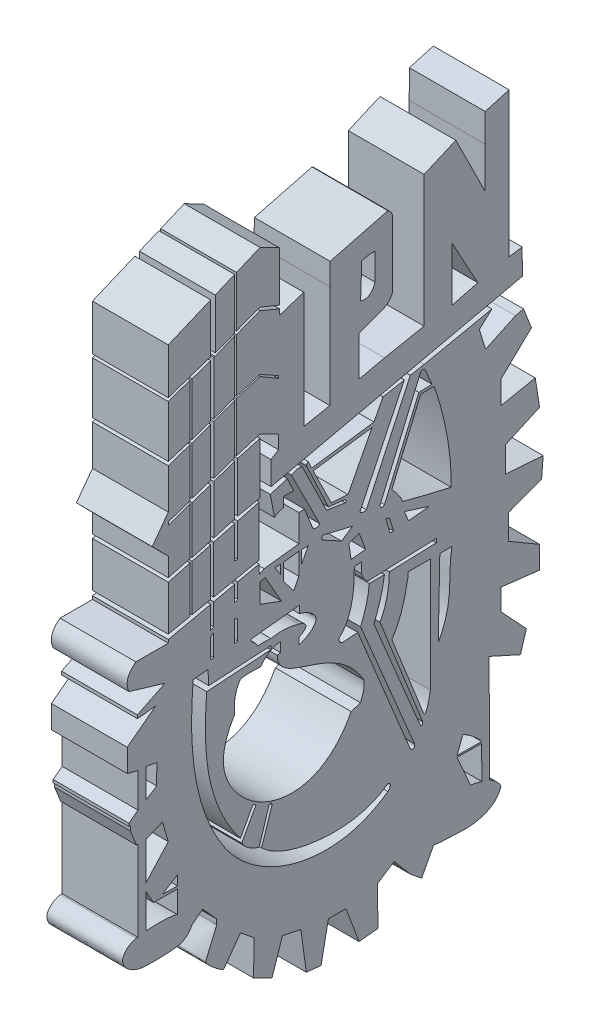
from build123d import *

# Parameters (mm, degrees)
SALIENTE_EXTRUIR1_DEPTH = 50


with BuildPart() as part:
    # Croquis1 → Saliente-Extruir1 (new body)
    # profile 1 of 43: a face of its own
    with BuildSketch(Plane(origin=(0, 0, 0), x_dir=(0, 0, -1), z_dir=(1, 0, 0))):
        Polygon((71.898749222, 423.986579651), (43.936341055, 412.250038645), (43.936341055, 382.06038761), (71.898749222, 391.521415956), align=None)
    # profile 2 of 43: a face of its own
    with BuildSketch(Plane(origin=(0, 0, 0), x_dir=(0, 0, -1), z_dir=(1, 0, 0))):
        Polygon((73.916073118, 253.199431665), (103.895805181, 259.388700441), (103.895805181, 292.514218648), (89.728183203, 288.780712422), (89.728183203, 266.926781339), (87.726805745, 266.926781339), (87.726805745, 288.253301738), (73.916073118, 284.613844367), align=None)
    # profile 3 of 43: a face of its own
    with BuildSketch(Plane(origin=(0, 0, 0), x_dir=(0, 0, -1), z_dir=(1, 0, 0))):
        Polygon((58.368181801, 385.033227833), (43.936341055, 379.908767048), (43.936341055, 345.68604184), (58.368181801, 350.141365421), align=None)
    # profile 4 of 43: a face of its own
    with BuildSketch(Plane(origin=(0, 0, 0), x_dir=(0, 0, -1), z_dir=(1, 0, 0))):
        Polygon((87.705715237, 430.621169338), (74.9479452, 425.266405531), (74.9479452, 392.199758009), (87.705715237, 396.988833984), align=None)
    # profile 5 of 43: a face of its own
    with BuildSketch(Plane(origin=(0, 0, 0), x_dir=(0, 0, -1), z_dir=(1, 0, 0))):
        Polygon((58.368181801, 348.138972285), (43.936341055, 343.228373382), (43.936341055, 316.742844044), (43.936341055, 311.080163837), (58.368181801, 315.99076274), align=None)
    # profile 6 of 43: a face of its own
    with BuildSketch(Plane(origin=(0, 0, 0), x_dir=(0, 0, -1), z_dir=(1, 0, 0))):
        Polygon((104.466666859, 437.65617129), (88.937059505, 431.137996158), (88.937059505, 397.685067551), (104.466666859, 403.514649779), align=None)
    # profile 7 of 43: a face of its own
    with BuildSketch(Plane(origin=(0, 0, 0), x_dir=(0, 0, -1), z_dir=(1, 0, 0))):
        Polygon((43.936341055, 311.080163837), (43.936341055, 316.742844044), (33.362046698, 302.30203035), (43.936341055, 291.60463238), (43.936341055, 309.262121132), align=None)
    # profile 8 of 43: a face of its own
    with BuildSketch(Plane(origin=(0, 0, 0), x_dir=(0, 0, -1), z_dir=(1, 0, 0))):
        Polygon((117.145314556, 431.137996158), (104.466666859, 437.65617129), (104.466666859, 403.514649779), (117.271614369, 398.307309176), align=None)
    # profile 9 of 43: a face of its own
    with BuildSketch(Plane(origin=(0, 0, 0), x_dir=(0, 0, -1), z_dir=(1, 0, 0))):
        Polygon((58.368181801, 314.425748049), (43.936341055, 309.262121132), (43.936341055, 291.60463238), (43.936341055, 279.260380234), (58.368181801, 283.074487302), align=None)
    # profile 10 of 43: a face of its own
    with BuildSketch(Plane(origin=(0, 0, 0), x_dir=(0, 0, -1), z_dir=(1, 0, 0))):
        with BuildLine():
            Line((127.195424074, 395.678228148), (125.612811259, 395.157013913))
            Line((125.612811259, 395.157013913), (123.325114539, 394.40358889))
            Line((123.325114539, 394.40358889), (119.278791308, 393.070981669))
            Line((119.278791308, 393.070981669), (117.195025367, 392.384718762))
            Line((117.195025367, 392.384718762), (116.633411279, 392.199758009))
            Line((116.633411279, 392.199758009), (116.633411279, 358.379950842))
            Line((116.633411279, 358.379950842), (116.633411279, 356.725577561))
            Line((116.633411279, 356.725577561), (116.633411279, 325.03830582))
            Line((116.633411279, 325.03830582), (116.633411279, 323.347956388))
            Line((116.633411279, 323.347956388), (116.633411279, 315.99076274))
            Line((116.633411279, 315.99076274), (111.720551129, 312.859427749))
            Line((111.720551129, 312.859427749), (111.720551129, 297.338928816))
            Line((111.720551129, 297.338928816), (118.018844332, 298.757778998))
            Line((118.018844332, 298.757778998), (277.47574818, 334.679488205))
            Line((277.47574818, 334.679488205), (277.333116207, 351.510061011))
            Line((277.333116207, 351.510061011), (268.715398606, 350.141365421))
            Line((268.715398606, 350.141365421), (268.715398606, 445.593998272))
            Line((268.715398606, 445.593998272), (252.965704808, 441.073429233))
            Line((252.965704808, 441.073429233), (252.825634946, 422.514172575))
            Line((252.825634946, 422.514172575), (252.825634946, 395.678228148))
            Line((252.825634946, 395.678228148), (233.601046445, 434.315058412))
            Line((233.601046445, 434.315058412), (212.688280051, 425.266405531))
            Line((212.688280051, 425.266405531), (212.654407131, 338.606665387))
            Line((212.654407131, 338.606665387), (186.53637552, 333.535575167))
            Line((186.53637552, 333.535575167), (169.745202862, 329.743408155))
            Line((169.745202862, 329.743408155), (169.745202862, 356.093117206))
            Line((169.745202862, 356.093117206), (183.700214161, 361.130563816))
            add(Edge.make_bspline(
                [(191.944134335, 368.609986726), (189.816913756, 362.970580768), (183.700214161, 361.130563816)],
                knots=[0, 0, 0, 1, 1, 1], degree=2))
            Line((191.944134335, 368.609986726), (191.944134335, 411.037188545))
            add(Edge.make_bspline(
                [(188.778092323, 416.481591911), (191.866057428, 414.547436067), (191.944134335, 411.037188545)],
                knots=[0, 0, 0, 1, 1, 1], degree=2))
            Line((188.778092323, 416.481591911), (150.689665983, 406.630514623))
            Line((150.689665983, 406.630514623), (150.532611088, 392.199758009))
            Line((150.532611088, 392.199758009), (150.532611088, 324.330689516))
            Line((150.532611088, 324.330689516), (133.2889832, 320.95991941))
            Line((133.2889832, 320.95991941), (133.2889832, 397.685067551))
            Line((133.2889832, 397.685067551), (127.195424074, 395.678228148))
        make_face()
        with BuildLine():
            Line((170.761553578, 373.778644786), (171.538337189, 396.530829336))
            add(Edge.make_bspline(
                [(171.538337189, 396.530829336), (175.222304974, 397.715856864), (180.379859683, 397.685067551)],
                knots=[0, 0, 0, 1, 1, 1], degree=2))
            Line((180.379859683, 397.685067551), (180.379859683, 379.908767048))
            add(Edge.make_bspline(
                [(170.761553578, 373.778644786), (177.432737418, 371.951536933), (180.379859683, 379.908767048)],
                knots=[0, 0, 0, 1, 1, 1], degree=2))
        make_face(mode=Mode.SUBTRACT)
        Polygon((230.978474279, 341.287804932), (230.978474279, 377.04914381), (248.107855086, 345.68604184), align=None, mode=Mode.SUBTRACT)
    # profile 11 of 43: a face of its own
    with BuildSketch(Plane(origin=(0, 0, 0), x_dir=(0, 0, -1), z_dir=(1, 0, 0))):
        Polygon((58.368181801, 280.516604257), (43.936341055, 276.713470085), (43.936341055, 252.084753531), (43.936341055, 247.010162889), (58.368181801, 249.98959383), (58.368181801, 250.770316035), align=None)
    # profile 12 of 43: a face of its own
    with BuildSketch(Plane(origin=(0, 0, 0), x_dir=(0, 0, -1), z_dir=(1, 0, 0))):
        with BuildLine():
            Line((116.633411279, 392.199758009), (117.195025367, 392.384718762))
            add(Edge.make_bspline(
                [(117.244293794, 396.194622357), (117.219659579, 394.289670459), (117.195025367, 392.384718762)],
                knots=[0.356716651, 0.356716651, 0.356716651, 1, 1, 1], degree=2))
            Line((117.244293794, 396.194622357), (104.466666859, 401.507810376))
            Line((104.466666859, 401.507810376), (104.466666859, 365.104856268))
            Line((104.466666859, 365.104856268), (116.633411279, 358.379950842))
            Line((116.633411279, 358.379950842), (116.633411279, 392.199758009))
        make_face()
    # profile 13 of 43: a face of its own
    with BuildSketch(Plane(origin=(0, 0, 0), x_dir=(0, 0, -1), z_dir=(1, 0, 0))):
        Polygon((71.898749222, 250.119644476), (43.936341055, 243.981077979), (43.936341055, 241.873751885), (43.936341055, 221.235649444), (71.898749222, 235.185414697), align=None)
    # profile 14 of 43: a face of its own
    with BuildSketch(Plane(origin=(0, 0, 0), x_dir=(0, 0, -1), z_dir=(1, 0, 0))):
        with BuildLine():
            Line((43.936341055, 221.235649444), (43.936341055, 241.873751885))
            Line((43.936341055, 241.873751885), (22.538929916, 241.873751885))
            add(Edge.make_bspline(
                [(22.538929916, 241.873751885), (14.224246836, 235.779300394), (17.997803609, 227.208813905)],
                knots=[0, 0, 0, 1, 1, 1], degree=2))
            Line((17.997803609, 227.208813905), (41.686429292, 220.111841968))
            Line((41.686429292, 220.111841968), (43.936341055, 221.235649444))
        make_face()
    # profile 15 of 43: a face of its own
    with BuildSketch(Plane(origin=(0, 0, 0), x_dir=(0, 0, -1), z_dir=(1, 0, 0))):
        Polygon((104.466666859, 365.104856268), (104.466666859, 401.507810376), (88.937059505, 395.678228148), (88.937059505, 360.388971313), align=None)
    # profile 16 of 43: a face of its own
    with BuildSketch(Plane(origin=(0, 0, 0), x_dir=(0, 0, -1), z_dir=(1, 0, 0))):
        with BuildLine():
            Line((71.898749222, 235.185414697), (43.936341055, 221.235649444))
            Line((43.936341055, 221.235649444), (41.686429292, 220.111841968))
            Line((41.686429292, 220.111841968), (23.588717704, 211.072223648))
            Line((23.588717704, 211.072223648), (23.588717704, 208.898937309))
            Line((23.588717704, 208.898937309), (35.536757225, 210.177526139))
            Line((35.536757225, 210.177526139), (42.738962819, 210.948251713))
            Line((42.738962819, 210.948251713), (60.32255463, 212.829914728))
            Line((60.32255463, 212.829914728), (70.130185405, 213.879453201))
            Line((70.130185405, 213.879453201), (98.354292369, 216.899783677))
            Line((98.354292369, 216.899783677), (111.720551129, 218.330139604))
            Line((111.720551129, 218.330139604), (118.186281565, 219.022053177))
            Line((118.186281565, 219.022053177), (130.559891325, 220.346183315))
            Line((130.559891325, 220.346183315), (166.621547717, 224.205229058))
            Line((166.621547717, 224.205229058), (171.452686877, 224.722221034))
            Line((171.452686877, 224.722221034), (239.34837422, 231.987904016))
            add(Edge.make_bspline(
                [(142.790917372, 257.143934178), (192.582301675, 246.655666331), (239.34837422, 231.987904016)],
                knots=[0, 0, 0, 1, 1, 1], degree=2))
            Line((142.790917372, 257.143934178), (130.041459975, 255.582348147))
            Line((130.041459975, 255.582348147), (117.932940925, 254.099265877))
            Line((117.932940925, 254.099265877), (107.168963064, 252.780866439))
            Line((107.168963064, 252.780866439), (103.940966718, 251.170497583))
            Line((103.940966718, 251.170497583), (89.728183203, 244.080085611))
            Line((89.728183203, 244.080085611), (87.726805745, 243.08164708))
            Line((87.726805745, 243.08164708), (73.916073118, 236.191808517))
            Line((73.916073118, 236.191808517), (71.898749222, 235.185414697))
        make_face()
        Polygon((71.898749222, 218.432718829), (40.071022525, 215.560690237), (71.898749222, 231.987904016), (73.916073118, 233.029103446), (80.350585673, 236.350142184), (87.726805745, 233.818006936), (89.728183203, 233.130966913), (119.921417504, 222.766125287), (89.728183203, 220.041587872), (87.726805745, 219.860990202), (73.916073118, 218.614755453), align=None, mode=Mode.SUBTRACT)
        Polygon((85.79239534, 238.640120878), (108.301490285, 250.770316035), (123.325114539, 225.400040329), align=None, mode=Mode.SUBTRACT)
        Polygon((111.720551129, 250.696402942), (139.464489967, 254.153673827), (126.612399461, 225.400040329), align=None, mode=Mode.SUBTRACT)
        Polygon((144.700693672, 255.068455097), (170.761553578, 247.96327152), (130.041459975, 224.806996061), align=None, mode=Mode.SUBTRACT)
        Polygon((174.619246656, 247.010162889), (226.280889498, 233.333507933), (132.356075822, 224.206910471), align=None, mode=Mode.SUBTRACT)
    # profile 17 of 43: a face of its own
    with BuildSketch(Plane(origin=(0, 0, 0), x_dir=(0, 0, -1), z_dir=(1, 0, 0))):
        Polygon((116.633411279, 325.03830582), (116.633411279, 356.725577561), (104.466666859, 363.951072191), (104.466666859, 331.130836269), align=None)
    # profile 18 of 43: a face of its own
    with BuildSketch(Plane(origin=(0, 0, 0), x_dir=(0, 0, -1), z_dir=(1, 0, 0))):
        Polygon((73.916073118, 250.562506078), (73.916073118, 236.191808517), (87.726805745, 243.08164708), (87.726805745, 253.594365856), align=None)
    # profile 19 of 43: a face of its own
    with BuildSketch(Plane(origin=(0, 0, 0), x_dir=(0, 0, -1), z_dir=(1, 0, 0))):
        Polygon((104.466666859, 331.130836269), (104.466666859, 363.951072191), (88.937059505, 359.205579357), (88.937059505, 326.385343435), align=None)
    # profile 20 of 43: a face of its own
    with BuildSketch(Plane(origin=(0, 0, 0), x_dir=(0, 0, -1), z_dir=(1, 0, 0))):
        Polygon((89.728183203, 254.033726749), (89.728183203, 244.080085611), (103.940966718, 251.170497583), (103.895805181, 257.143934178), align=None)
    # profile 21 of 43: a face of its own
    with BuildSketch(Plane(origin=(0, 0, 0), x_dir=(0, 0, -1), z_dir=(1, 0, 0))):
        Polygon((104.466666859, 294.593691959), (104.466666859, 328.617108748), (89.728183203, 324.54905227), (89.728183203, 291.611790835), align=None)
    # profile 22 of 43: a face of its own
    with BuildSketch(Plane(origin=(0, 0, 0), x_dir=(0, 0, -1), z_dir=(1, 0, 0))):
        Polygon((23.931230249, 197.716090348), (35.536757225, 210.177526139), (16.872126566, 195.968439978), (16.872126566, 180.932435704), (23.931230249, 179.134188047), align=None)
    # profile 23 of 43: a face of its own
    with BuildSketch(Plane(origin=(0, 0, 0), x_dir=(0, 0, -1), z_dir=(1, 0, 0))):
        with BuildLine():
            Line((42.738962819, 210.948251713), (35.536757225, 210.177526139))
            Line((35.536757225, 210.177526139), (23.931230249, 197.716090348))
            Line((23.931230249, 197.716090348), (23.931230249, 179.134188047))
            Line((23.931230249, 179.134188047), (23.931230249, 156.514855948))
            Line((23.931230249, 156.514855948), (23.931230249, 137.097250575))
            Line((23.931230249, 137.097250575), (23.931230249, 83.831096611))
            Line((23.931230249, 83.831096611), (22.947098005, 83.831096611))
            add(Edge.make_bspline(
                [(22.947098005, 83.831096611), (19.234712646, 83.675555653), (13.380407684, 79.049287764), (14.33984678, 69.927150792), (21.278273748, 66.068099962), (29.653879396, 64.54596886), (53.740319571, 65.052337857), (54.032212628, 67.335921664), (56.013443111, 68.342478813)],
                knots=[0, 0, 0, 0, 0.18208765, 0.22609958, 0.49674236, 0.557462277, 0.772578832, 1, 1, 1, 1], degree=3))
            add(Edge.make_bspline(
                [(56.013443111, 68.342478813), (57.951236989, 70.215335621), (59.607013616, 73.070583901)],
                knots=[0, 0, 0, 1, 1, 1], degree=2))
            add(Edge.make_bspline(
                [(54.154243966, 81.43162034), (56.045749575, 80.243554831), (59.387707173, 77.533275019), (60.142323178, 74.512585778), (59.607013616, 73.070583901)],
                knots=[0, 0, 0, 0, 0.648367557, 1, 1, 1, 1], degree=3))
            Line((54.154243966, 81.43162034), (54.154243966, 197.568555614))
            Line((54.154243966, 197.568555614), (42.738962819, 210.948251713))
        make_face()
        with BuildLine():
            Line((50.006428245, 98.480894204), (50.006428245, 83.841064303))
            add(Edge.make_bspline(
                [(50.006428245, 83.841064303), (46.163012842, 85.740114008), (31.375606902, 85.200773844), (29.085301289, 84.890033252)],
                knots=[0, 0, 0, 0, 1, 1, 1, 1], degree=3))
            Line((29.085301289, 84.890033252), (29.085301289, 107.590382288))
            Line((29.085301289, 107.590382288), (29.085301289, 112.208674811))
            Line((29.085301289, 112.208674811), (29.085301289, 137.097250575))
            Line((29.085301289, 137.097250575), (29.085301289, 159.549588882))
            Line((29.085301289, 159.549588882), (29.085301289, 178.868154715))
            Line((29.085301289, 178.868154715), (29.085301289, 199.518181191))
            Line((29.085301289, 199.518181191), (39.161497565, 209.054380311))
            Line((39.161497565, 209.054380311), (50.006428245, 197.595344196))
            Line((50.006428245, 197.595344196), (50.006428245, 106.586388182))
            Line((50.006428245, 106.586388182), (50.006428245, 100.203967153))
            Line((50.006428245, 100.203967153), (50.006428245, 98.480894204))
        make_face(mode=Mode.SUBTRACT)
    # profile 24 of 43: a face of its own
    with BuildSketch(Plane(origin=(0, 0, 0), x_dir=(0, 0, -1), z_dir=(1, 0, 0))):
        with BuildLine():
            Line((60.32255463, 212.829914728), (42.738962819, 210.948251713))
            Line((42.738962819, 210.948251713), (54.154243966, 197.568555614))
            Line((54.154243966, 197.568555614), (54.154243966, 81.43162034))
            add(Edge.make_bspline(
                [(54.154243966, 81.43162034), (56.045749575, 80.243554831), (59.387707173, 77.533275019), (60.142323178, 74.512585778), (59.607013616, 73.070583901)],
                knots=[0, 0, 0, 0, 0.648367557, 1, 1, 1, 1], degree=3))
            Line((59.607013616, 73.070583901), (66.588690944, 78.655375136))
            Line((66.588690944, 78.655375136), (75.87147495, 68.342478813))
            Line((75.87147495, 68.342478813), (75.87147495, 65.216713672))
            add(Edge.make_bspline(
                [(75.87147495, 65.216713672), (75.732447777, 63.727146112), (71.862641907, 56.118540469), (69.083086849, 49.232942015), (67.791273487, 45.736805226), (77.895172714, 38.377277636), (80.350585673, 37.175206943)],
                knots=[0, 0, 0, 0, 0.597772721, 0.693632468, 0.735053442, 1, 1, 1, 1], degree=3))
            Line((80.350585673, 37.175206943), (91.525155792, 52.577813142))
            Line((91.525155792, 52.577813142), (100.596826001, 45.365091746))
            Line((100.596826001, 45.365091746), (100.430154009, 37.169335529))
            Line((100.430154009, 37.169335529), (100.132534945, 22.534523432))
            Line((100.132534945, 22.534523432), (112.368019297, 16.557336889))
            Line((112.368019297, 16.557336889), (119.257388038, 37.169335529))
            Line((119.257388038, 37.169335529), (131.376036666, 34.652305389))
            Line((131.376036666, 34.652305389), (133.2889832, 20.577031586))
            Line((133.2889832, 20.577031586), (134.943240795, 8.405165732))
            Line((134.943240795, 8.405165732), (144.700693672, 7.36208995))
            Line((144.700693672, 7.36208995), (149.545413228, 31.640777736))
            Line((149.545413228, 31.640777736), (161.165274946, 31.596257193))
            Line((161.165274946, 31.596257193), (168.884979136, 10.833699166))
            Line((168.884979136, 10.833699166), (169.745202862, 8.520081368))
            Line((169.745202862, 8.520081368), (182.272537812, 9.802743674))
            Line((182.272537812, 9.802743674), (181.795666, 35.422285159))
            Line((181.795666, 35.422285159), (192.903280042, 42.653880918))
            Line((192.903280042, 42.653880918), (197.028784945, 37.814328324))
            Line((197.028784945, 37.814328324), (203.582254504, 30.126575832))
            Line((203.582254504, 30.126575832), (211.018693621, 24.122408133))
            Line((211.018693621, 24.122408133), (218.934140282, 39.023029963))
            add(Edge.make_bspline(
                [(218.934140282, 39.023029963), (212.733337731, 40.127804057), (206.660253852, 42.708964891), (202.041098184, 49.007813529)],
                knots=[0.724993146, 0.724993146, 0.724993146, 0.724993146, 1, 1, 1, 1], degree=3))
            add(Edge.make_bspline(
                [(202.041098184, 49.007813529), (205.210483516, 55.557876549), (211.132185441, 58.898690381), (217.917663918, 60.48292828)],
                knots=[0, 0, 0, 0, 0.448656408, 0.448656408, 0.448656408, 0.448656408], degree=3))
            Line((217.917663918, 60.48292828), (218.934140282, 128.552553502))
            Line((218.934140282, 128.552553502), (222.438605284, 136.285356324))
            Line((222.438605284, 136.285356324), (221.991157786, 61.222727363))
            add(Edge.make_bspline(
                [(221.991157786, 61.222727363), (229.27500406, 62.205794954), (237.08570771, 61.618271066), (243.341783668, 61.061243113)],
                knots=[0.53655709, 0.53655709, 0.53655709, 0.53655709, 1, 1, 1, 1], degree=3))
            Line((243.341783668, 61.061243113), (234.348305634, 81.43162034))
            Line((234.348305634, 81.43162034), (250.623186624, 81.261619494))
            Line((250.623186624, 81.261619494), (250.745345744, 59.474765525))
            Line((250.745345744, 59.474765525), (250.625856403, 45.365091746))
            Line((250.625856403, 45.365091746), (255.942429299, 48.448263))
            Line((255.942429299, 48.448263), (255.915145483, 57.796638695))
            Line((255.915145483, 57.796638695), (255.846661478, 81.261619494))
            Line((255.846661478, 81.261619494), (255.771166218, 107.128898098))
            Line((255.771166218, 107.128898098), (255.487518656, 107.590382288))
            Line((255.487518656, 107.590382288), (255.487518656, 114.852061232))
            Line((255.487518656, 114.852061232), (255.487518656, 128.552553502))
            Line((255.487518656, 128.552553502), (255.708933405, 128.452005148))
            Line((255.708933405, 128.452005148), (276.192060423, 119.150254885))
            Line((276.192060423, 119.150254885), (280.126324536, 132.099961346))
            Line((280.126324536, 132.099961346), (263.365817499, 150.073915409))
            Line((263.365817499, 150.073915409), (263.365817499, 164.154268056))
            Line((263.365817499, 164.154268056), (285.020127066, 161.611143474))
            Line((285.020127066, 161.611143474), (288.851099201, 161.161226593))
            Line((288.851099201, 161.161226593), (288.851099201, 175.896199949))
            Line((288.851099201, 175.896199949), (268.337018723, 187.83883529))
            Line((268.337018723, 187.83883529), (268.337018723, 204.316331022))
            Line((268.337018723, 204.316331022), (290.148691794, 212.472387059))
            Line((290.148691794, 212.472387059), (291.211524846, 225.400040329))
            Line((291.211524846, 225.400040329), (266.217562697, 227.208813905))
            Line((266.217562697, 227.208813905), (266.217562697, 243.981077979))
            Line((266.217562697, 243.981077979), (288.851099201, 254.153673827))
            Line((288.851099201, 254.153673827), (285.958276826, 272.396479961))
            Line((285.958276826, 272.396479961), (283.466291043, 271.893917233))
            Line((283.466291043, 271.893917233), (263.365817499, 267.840222825))
            Line((263.365817499, 267.840222825), (263.365817499, 283.074487302))
            Line((263.365817499, 283.074487302), (283.466291043, 302.30203035))
            Line((283.466291043, 302.30203035), (278.188908044, 315.709435805))
            Line((278.188908044, 315.709435805), (272.911525046, 314.425748049))
            Line((272.911525046, 314.425748049), (253.225220105, 305.154669808))
            Line((253.225220105, 305.154669808), (249.065004853, 318.42419809))
            Line((249.065004853, 318.42419809), (257.385435357, 326.051259386))
            Line((257.385435357, 326.051259386), (212.654407131, 316.742844044))
            add(Edge.make_bspline(
                [(212.654407131, 316.742844044), (208.118330991, 315.91312907), (203.582254504, 315.083414032)],
                knots=[0, 0, 0, 0.33500761, 0.33500761, 0.33500761], degree=2))
            Line((203.582254504, 315.083414032), (174.619246656, 252.780866439))
            add(Edge.make_bspline(
                [(170.297961352, 253.594365856), (171.892123894, 251.693236248), (174.619246656, 252.780866439)],
                knots=[0, 0, 0, 1, 1, 1], degree=2))
            Line((170.297961352, 253.594365856), (199.594270513, 314.353953164))
            add(Edge.make_bspline(
                [(199.594270513, 314.353953164), (192.584119751, 313.071693589), (185.573968629, 311.789433949)],
                knots=[0.48227199, 0.48227199, 0.48227199, 1, 1, 1], degree=2))
            add(Edge.make_bspline(
                [(185.573968629, 311.789433949), (182.592191263, 306.068084615), (179.610413733, 300.346734965)],
                knots=[0, 0, 0, 0.258232773, 0.258232773, 0.258232773], degree=2))
            Line((179.610413733, 300.346734965), (138.506772685, 294.593691959))
            add(Edge.make_bspline(
                [(138.506772685, 294.593691959), (137.392080356, 297.014002199), (136.277388091, 299.434312303)],
                knots=[0.300497837, 0.300497837, 0.300497837, 1, 1, 1], degree=2))
            add(Edge.make_bspline(
                [(135.266571951, 297.338928816), (134.870880609, 298.961406578), (136.277388091, 299.434312303)],
                knots=[0, 0, 0, 1, 1, 1], degree=2))
            Line((135.266571951, 297.338928816), (149.545413228, 266.926781339))
            Line((149.545413228, 266.926781339), (160.645964076, 265.664802508))
            add(Edge.make_bspline(
                [(160.645964076, 265.664802508), (161.680785322, 264.450529379), (160.645964076, 263.673357213)],
                knots=[0, 0, 0, 1, 1, 1], degree=2))
            Line((160.645964076, 263.673357213), (148.284801988, 265.664802508))
            Line((148.284801988, 265.664802508), (132.204518379, 298.589566069))
            add(Edge.make_bspline(
                [(125.128949693, 297.354915811), (128.600185523, 299.430452004), (132.204518379, 298.589566069)],
                knots=[0, 0, 0, 1, 1, 1], degree=2))
            Line((125.128949693, 297.354915811), (143.705022729, 260.325107588))
            add(Edge.make_bspline(
                [(139.464489967, 259.388700441), (142.735924023, 258.020193927), (143.705022729, 260.325107588)],
                knots=[0, 0, 0, 1, 1, 1], degree=2))
            Line((139.464489967, 259.388700441), (133.748065414, 273.569695156))
            add(Edge.make_bspline(
                [(130.041459975, 273.444690802), (131.655793121, 273.486869527), (133.085863297, 273.534299095), (133.748065414, 273.569695156)],
                knots=[0.748912607, 0.748912607, 0.748912607, 0.748912607, 1, 1, 1, 1], degree=3))
            Line((130.041459975, 273.444690802), (130.041459975, 255.582348147))
            Line((130.041459975, 255.582348147), (142.790917372, 257.143934178))
            add(Edge.make_bspline(
                [(142.790917372, 257.143934178), (192.582301675, 246.655666331), (239.34837422, 231.987904016)],
                knots=[0, 0, 0, 1, 1, 1], degree=2))
            Line((239.34837422, 231.987904016), (171.452686877, 224.722221034))
            Line((171.452686877, 224.722221034), (171.528049386, 217.613507032))
            add(Edge.make_bspline(
                [(171.528049386, 217.613507032), (172.086082654, 214.374097571), (175.462247484, 211.506692073)],
                knots=[0, 0, 0, 1, 1, 1], degree=2))
            Line((175.462247484, 211.506692073), (220.694133552, 213.35501426))
            Line((220.694133552, 213.35501426), (220.694133552, 210.798170604))
            Line((220.694133552, 210.798170604), (189.770843452, 209.747975905))
            add(Edge.make_bspline(
                [(189.770843452, 209.747975905), (189.569081448, 194.456224186), (183.523520796, 184.145461777)],
                knots=[0, 0, 0, 1, 1, 1], degree=2))
            Line((183.523520796, 184.145461777), (211.682768479, 113.279540916))
            add(Edge.make_bspline(
                [(210.351174226, 111.404848211), (212.041762212, 111.071513561), (211.682768479, 113.279540916)],
                knots=[0, 0, 0, 1, 1, 1], degree=2))
            Line((210.351174226, 111.404848211), (179.610413733, 184.83377358))
            add(Edge.make_bspline(
                [(186.53637552, 209.747975905), (185.233178505, 201.258530327), (183.47701006, 194.733846879), (179.610413733, 184.83377358)],
                knots=[0, 0, 0, 0, 1, 1, 1, 1], degree=3))
            Line((186.53637552, 209.747975905), (176.505758741, 209.747975905))
            add(Edge.make_bspline(
                [(176.505758741, 209.747975905), (175.936690638, 200.354149175), (170.761553578, 187.83883529)],
                knots=[0, 0, 0, 1, 1, 1], degree=2))
            Line((170.761553578, 187.83883529), (206.399902149, 103.130655057))
            add(Edge.make_bspline(
                [(203.582254504, 101.560985634), (206.572136399, 99.267927785), (206.399902149, 103.130655057)],
                knots=[0, 0, 0, 1, 1, 1], degree=2))
            Line((203.582254504, 101.560985634), (168.884979136, 185.611460089))
            Line((168.884979136, 185.611460089), (158.48699204, 184.83377358))
            add(Edge.make_bspline(
                [(158.48699204, 184.83377358), (155.947829411, 186.363177492), (156.492081601, 188.437840434)],
                knots=[0, 0, 0, 1, 1, 1], degree=2))
            add(Edge.make_bspline(
                [(166.621547717, 224.205229058), (167.197353641, 197.859513468), (156.492081601, 188.437840434)],
                knots=[0, 0, 0, 1, 1, 1], degree=2))
            Line((166.621547717, 224.205229058), (130.559891325, 220.346183315))
            Line((130.559891325, 220.346183315), (130.370984642, 215.560690237))
            add(Edge.make_bspline(
                [(130.183628074, 197.568555614), (136.163503899, 199.885747373), (140.76354054, 203.146835313), (141.87531259, 209.575621376), (136.902949826, 213.736985919), (130.370984642, 215.560690237)],
                knots=[0, 0, 0, 0, 0.484081153, 0.584081153, 1, 1, 1, 1], degree=3))
            Line((130.183628074, 197.568555614), (130.103190859, 202.053834688))
            add(Edge.make_bspline(
                [(130.103190859, 202.053834688), (139.298707612, 206.833206015), (130.041459975, 209.747975905)],
                knots=[0, 0, 0, 1, 1, 1], degree=2))
            add(Edge.make_bspline(
                [(130.041459975, 209.747975905), (120.710800902, 212.619082219), (111.720551129, 210.629531151)],
                knots=[0, 0, 0, 1, 1, 1], degree=2))
            add(Edge.make_bspline(
                [(111.720551129, 210.629531151), (108.903716419, 211.089180352), (105.752838828, 211.119156805), (102.652444638, 210.798170604)],
                knots=[0.467168194, 0.467168194, 0.467168194, 0.467168194, 1, 1, 1, 1], degree=3))
            add(Edge.make_bspline(
                [(102.652444638, 210.798170604), (102.482988106, 213.707594308), (98.212600522, 214.28684073), (98.354292369, 216.899783677)],
                knots=[0, 0, 0, 0, 1, 1, 1, 1], degree=3))
            Line((98.354292369, 216.899783677), (70.130185405, 213.879453201))
            Line((70.130185405, 213.879453201), (70.587879511, 204.316331022))
            Line((70.587879511, 204.316331022), (111.720551129, 206.659728751))
            Line((111.720551129, 206.659728751), (111.561856804, 204.316331022))
            Line((111.561856804, 204.316331022), (69.250473424, 201.532630536))
            add(Edge.make_bspline(
                [(69.250473424, 201.532630536), (66.677779768, 167.240465015), (68.64080152, 136.650690838), (91.525155792, 106.586388182)],
                knots=[0, 0, 0, 0, 1, 1, 1, 1], degree=3))
            Line((91.525155792, 106.586388182), (99.68211487, 121.593436697))
            add(Edge.make_bspline(
                [(99.68211487, 121.593436697), (101.515439836, 121.344877852), (101.661463473, 120.418198465)],
                knots=[0, 0, 0, 1, 1, 1], degree=2))
            Line((101.661463473, 120.418198465), (92.321412254, 103.531880697))
            add(Edge.make_bspline(
                [(92.321412254, 103.531880697), (95.793395591, 97.624042673), (103.895805181, 95.367067711)],
                knots=[0, 0, 0, 1, 1, 1], degree=2))
            Line((103.895805181, 95.367067711), (110.444822898, 116.459501259))
            add(Edge.make_bspline(
                [(110.444822898, 116.459501259), (112.247204399, 117.406238503), (112.368019297, 115.34611767)],
                knots=[0, 0, 0, 1, 1, 1], degree=2))
            Line((112.368019297, 115.34611767), (105.496451391, 94.253684122))
            add(Edge.make_bspline(
                [(105.496451391, 94.253684122), (115.175889158, 84.231563107), (153.484077112, 74.942868505), (180.54798104, 82.848811002), (188.778092323, 89.341770114)],
                knots=[0, 0, 0, 0, 0.556817536, 1, 1, 1, 1], degree=3))
            add(Edge.make_bspline(
                [(188.778092323, 89.341770114), (191.267345676, 88.437818151), (190.579842957, 86.511934448), (188.778092323, 84.731006526)],
                knots=[0, 0, 0, 0, 1, 1, 1, 1], degree=3))
            add(Edge.make_bspline(
                [(60.32255463, 212.829914728), (56.766724573, 169.883996556), (63.6965921, 133.800281889), (92.845205203, 87.421672718), (134.716578412, 65.242240696), (175.146683856, 75.061935511), (188.778092323, 84.731006526)],
                knots=[0, 0, 0, 0, 0.417407266, 0.504328644, 0.828670982, 1, 1, 1, 1], degree=3))
        make_face()
        with BuildLine():
            add(Edge.make_bspline(
                [(118.052432532, 205.849157403), (114.955767409, 205.912174292), (109.07955416, 204.031844742), (104.841704616, 197.830511785)],
                knots=[0, 0, 0, 0, 0.841601778, 0.841601778, 0.841601778, 0.841601778], degree=3))
            Line((118.052432532, 205.849157403), (117.932940925, 199.518181191))
            add(Edge.make_bspline(
                [(117.932940925, 199.518181191), (117.191732045, 199.383833298), (116.463045652, 199.23443792), (115.746746886, 199.070669276)],
                knots=[0, 0, 0, 0, 0.008373394, 0.008373394, 0.008373394, 0.008373394], degree=3))
            add(Edge.make_bspline(
                [(115.746746886, 199.070669276), (115.991346588, 189.118688024), (145.263365914, 180.698760314), (163.315297115, 172.760391822), (172.875023528, 156.514855948)],
                knots=[0, 0, 0, 0, 0.341113223, 1, 1, 1, 1], degree=3))
            add(Edge.make_bspline(
                [(172.875023528, 156.514855948), (173.932040777, 151.896426772), (171.847754815, 148.137705812), (170.761553578, 144.43871096)],
                knots=[0, 0, 0, 0, 1, 1, 1, 1], degree=3))
            Line((170.761553578, 144.43871096), (164.5465746, 142.522392357))
            add(Edge.make_bspline(
                [(87.726805744, 179.334484572), (83.831925365, 173.333906202), (80.486786651, 163.912806098), (79.681891699, 146.431150194), (89.379300678, 129.751901447), (121.330146242, 110.668846998), (150.210646335, 114.711429684), (164.5465746, 142.522392357)],
                knots=[0.16451657, 0.16451657, 0.16451657, 0.16451657, 0.272846567, 0.326121243, 0.568552309, 0.638970574, 1, 1, 1, 1], degree=3))
            add(Edge.make_bspline(
                [(87.726805744, 179.334484572), (86.428311196, 189.937575174), (91.525155792, 197.568555614)],
                knots=[0, 0, 0, 1, 1, 1], degree=2))
            add(Edge.make_bspline(
                [(91.525155792, 197.568555614), (95.777870718, 198.657452479), (104.841704616, 197.830511785)],
                knots=[0, 0, 0, 1, 1, 1], degree=2))
        make_face(mode=Mode.SUBTRACT)
        with BuildLine():
            add(Edge.make_bspline(
                [(238.299345217, 92.598936252), (245.931170943, 88.413821487), (250.623186624, 82.383280807)],
                knots=[0, 0, 0, 1, 1, 1], degree=2))
            Line((250.623186624, 82.383280807), (234.348305634, 82.513297368))
            Line((234.348305634, 82.513297368), (238.299345217, 92.598936252))
        make_face(mode=Mode.SUBTRACT)
        with BuildLine():
            add(Edge.make_bspline(
                [(216.769981435, 128.552553502), (215.039851302, 117.628995158), (212.654407131, 116.874793419)],
                knots=[0, 0, 0, 1, 1, 1], degree=2))
            Line((212.654407131, 116.874793419), (191.353422326, 170.159912237))
            add(Edge.make_bspline(
                [(191.353422326, 170.159912237), (198.4820955, 179.963723512), (202.003914728, 200.521251894)],
                knots=[0, 0, 0, 1, 1, 1], degree=2))
            Line((202.003914728, 200.521251894), (202.003914728, 203.55816209))
            Line((202.003914728, 203.55816209), (216.769981435, 203.55816209))
            Line((216.769981435, 203.55816209), (216.769981435, 200.521251894))
            Line((216.769981435, 200.521251894), (216.769981435, 128.552553502))
        make_face(mode=Mode.SUBTRACT)
        with BuildLine():
            Line((221.991157786, 152.858215069), (223.022837663, 203.55816209))
            Line((223.022837663, 203.55816209), (230.978474279, 203.55816209))
            add(Edge.make_bspline(
                [(230.978474279, 203.55816209), (227.65858888, 184.829767026), (233.164326963, 174.839855406), (221.991157786, 152.858215069)],
                knots=[0, 0, 0, 0, 1, 1, 1, 1], degree=3))
        make_face(mode=Mode.SUBTRACT)
        with BuildLine():
            Line((162.480249784, 267.477865137), (151.437102272, 268.279736081))
            Line((151.437102272, 268.279736081), (139.464489967, 292.514218648))
            Line((139.464489967, 292.514218648), (178.321784535, 297.874150028))
            add(Edge.make_bspline(
                [(178.321784535, 297.874150028), (170.401017242, 282.67600774), (162.480249784, 267.477865137)],
                knots=[0.31403276, 0.31403276, 0.31403276, 1, 1, 1], degree=2))
        make_face(mode=Mode.SUBTRACT)
        with BuildLine():
            add(Edge.make_bspline(
                [(191.353422326, 255.793666639), (196.454232281, 250.782577783), (198.528679774, 245.517932325)],
                knots=[0, 0, 0, 1, 1, 1], degree=2))
            Line((191.353422326, 255.793666639), (210.351174226, 300.731725134))
            add(Edge.make_bspline(
                [(210.351174226, 300.731725134), (214.5150485, 301.221126974), (219.350425752, 300.871581631)],
                knots=[0, 0, 0, 1, 1, 1], degree=2))
            add(Edge.make_bspline(
                [(219.350425752, 300.871581631), (230.764293995, 267.605322741), (230.536208273, 237.678754162)],
                knots=[0, 0, 0, 1, 1, 1], degree=2))
            add(Edge.make_bspline(
                [(230.536208273, 237.678754162), (214.873222137, 241.126491687), (198.528679774, 245.517932325)],
                knots=[0, 0, 0, 1, 1, 1], degree=2))
        make_face(mode=Mode.SUBTRACT)
        with BuildLine():
            add(Edge.make_bspline(
                [(183.523520796, 250.696402942), (184.328118121, 247.816928012), (186.53637552, 249.770851353)],
                knots=[0, 0, 0, 1, 1, 1], degree=2))
            Line((183.523520796, 250.696402942), (210.351174226, 313.546178381))
            add(Edge.make_bspline(
                [(210.351174226, 313.546178381), (211.978964545, 314.893756038), (213.265288671, 313.546178381)],
                knots=[0, 0, 0, 1, 1, 1], degree=2))
            Line((213.265288671, 313.546178381), (217.917663918, 302.738485235))
            Line((217.917663918, 302.738485235), (209.183776515, 302.549984068))
            Line((209.183776515, 302.549984068), (186.53637552, 249.770851353))
        make_face(mode=Mode.SUBTRACT)
    # profile 25 of 43: a face of its own
    with BuildSketch(Plane(origin=(0, 0, 0), x_dir=(0, 0, -1), z_dir=(1, 0, 0))):
        with BuildLine():
            Line((117.920320202, 295.220908523), (111.215717999, 293.226679219))
            Line((111.215717999, 293.226679219), (114.036779459, 278.60301917))
            add(Edge.make_bspline(
                [(120.049195325, 281.39567388), (117.705250786, 280.950355201), (115.172081456, 279.865550804), (114.036779459, 278.60301917)],
                knots=[0, 0, 0, 0, 1, 1, 1, 1], degree=3))
            Line((120.049195325, 281.39567388), (119.921417504, 287.724184317))
            Line((119.921417504, 287.724184317), (126.612399461, 287.601872357))
            Line((126.612399461, 287.601872357), (122.443755326, 296.566367449))
            Line((122.443755326, 296.566367449), (117.920320202, 295.220908523))
        make_face()
    # profile 26 of 43: a face of its own
    with BuildSketch(Plane(origin=(0, 0, 0), x_dir=(0, 0, -1), z_dir=(1, 0, 0))):
        Polygon((23.931230249, 137.097250575), (23.931230249, 156.514855948), (17.997803609, 151.997832713), (17.997803609, 150.073915409), (18.959762261, 150.073915409), (18.959762261, 147.146215165), (22.947098005, 137.097250575), align=None)
    # profile 27 of 43: a face of its own
    with BuildSketch(Plane(origin=(0, 0, 0), x_dir=(0, 0, -1), z_dir=(1, 0, 0))):
        Polygon((34.251364819, 98.617139135), (50.006428245, 98.480894204), (50.006428245, 100.203967153), (40.071022525, 100.391685419), (50.006428245, 106.586388182), (50.006428245, 197.595344196), (39.161497565, 209.054380311), (29.085301289, 199.518181191), (29.085301289, 178.868154715), (36.367087045, 177.444232988), (36.26962457, 164.154268056), (29.085301289, 159.549588882), (29.085301289, 137.097250575), (40.071022525, 141.70037157), (43.936341055, 128.552553502), (29.085301289, 112.208674811), (29.085301289, 107.590382288), align=None)
    # profile 28 of 43: a face of its own
    with BuildSketch(Plane(origin=(0, 0, 0), x_dir=(0, 0, -1), z_dir=(1, 0, 0))):
        with BuildLine():
            add(Edge.make_bspline(
                [(218.934140282, 39.023029963), (212.733337731, 40.127804057), (206.660253852, 42.708964891), (202.041098184, 49.007813529)],
                knots=[0.724993146, 0.724993146, 0.724993146, 0.724993146, 1, 1, 1, 1], degree=3))
            add(Edge.make_bspline(
                [(238.299345217, 37.814328324), (237.17828143, 37.86367533), (231.486619282, 38.274926366), (224.49363155, 38.032515933), (218.934140282, 39.023029963)],
                knots=[0.420476198, 0.420476198, 0.420476198, 0.420476198, 0.478428578, 0.724993146, 0.724993146, 0.724993146, 0.724993146], degree=3))
            add(Edge.make_bspline(
                [(263.365817499, 50.777203469), (261.021373959, 40.897996653), (247.446122799, 37.572716999), (239.112738277, 37.778524373), (238.299345217, 37.814328324)],
                knots=[0, 0, 0, 0, 0.378428578, 0.420476198, 0.420476198, 0.420476198, 0.420476198], degree=3))
            add(Edge.make_bspline(
                [(263.365817499, 50.777203469), (261.523283961, 53.982414835), (257.943242808, 56.503496206)],
                knots=[0, 0, 0, 0.789844939, 0.789844939, 0.789844939], degree=2))
            add(Edge.make_bspline(
                [(257.943242808, 56.503496206), (256.990696643, 57.174283576), (255.915145483, 57.796638695)],
                knots=[0.789844939, 0.789844939, 0.789844939, 1, 1, 1], degree=2))
            Line((255.915145483, 57.796638695), (255.942429299, 48.448263))
            Line((255.942429299, 48.448263), (250.625856403, 45.365091746))
            Line((250.625856403, 45.365091746), (250.745345744, 59.474765525))
            add(Edge.make_bspline(
                [(243.341783668, 61.061243113), (245.040623859, 61.070510543), (250.745345744, 59.474765525)],
                knots=[0, 0, 0, 1, 1, 1], degree=2))
            add(Edge.make_bspline(
                [(221.991157786, 61.222727363), (229.27500406, 62.205794954), (237.08570771, 61.618271066), (243.341783668, 61.061243113)],
                knots=[0.53655709, 0.53655709, 0.53655709, 0.53655709, 1, 1, 1, 1], degree=3))
            add(Edge.make_bspline(
                [(217.917663918, 60.48292828), (219.24707364, 60.793311884), (220.609639058, 61.036270066), (221.991157786, 61.222727363)],
                knots=[0.448656408, 0.448656408, 0.448656408, 0.448656408, 0.53655709, 0.53655709, 0.53655709, 0.53655709], degree=3))
            add(Edge.make_bspline(
                [(202.041098184, 49.007813529), (205.210483516, 55.557876549), (211.132185441, 58.898690381), (217.917663918, 60.48292828)],
                knots=[0, 0, 0, 0, 0.448656408, 0.448656408, 0.448656408, 0.448656408], degree=3))
        make_face()
    # profile 29 of 43: a face of its own
    with BuildSketch(Plane(origin=(0, 0, 0), x_dir=(0, 0, -1), z_dir=(1, 0, 0))):
        with BuildLine():
            Line((218.934140282, 128.552553502), (217.917663918, 60.48292828))
            add(Edge.make_bspline(
                [(217.917663918, 60.48292828), (219.24707364, 60.793311884), (220.609639058, 61.036270066), (221.991157786, 61.222727363)],
                knots=[0.448656408, 0.448656408, 0.448656408, 0.448656408, 0.53655709, 0.53655709, 0.53655709, 0.53655709], degree=3))
            Line((221.991157786, 61.222727363), (222.438605284, 136.285356324))
            Line((222.438605284, 136.285356324), (218.934140282, 128.552553502))
        make_face()
    # profile 30 of 43: a face of its own
    with BuildSketch(Plane(origin=(0, 0, 0), x_dir=(0, 0, -1), z_dir=(1, 0, 0))):
        Polygon((132.356075822, 224.206910471), (226.280889498, 233.333507933), (174.619246656, 247.010162889), align=None)
        Polygon((164.485863136, 229.409337171), (163.036370792, 239.288268664), (169.745202862, 241.873751885), (174.166426643, 230.401525863), align=None, mode=Mode.SUBTRACT)
        Polygon((190.160586413, 231.659268499), (187.465908953, 241.315883633), (189.770843452, 240.44757764), (192.528693666, 231.659268499), align=None, mode=Mode.SUBTRACT)
        Polygon((202.433152926, 232.563406974), (199.594270513, 239.288268664), (215.972486646, 233.955640591), align=None, mode=Mode.SUBTRACT)
    # profile 31 of 43: a face of its own
    with BuildSketch(Plane(origin=(0, 0, 0), x_dir=(0, 0, -1), z_dir=(1, 0, 0))):
        Polygon((130.041459975, 224.806996061), (170.761553578, 247.96327152), (144.700693672, 255.068455097), align=None)
        Polygon((145.317344223, 250.119644476), (145.317344223, 252.780866439), (165.452191365, 247.96327152), (158.207342417, 243.08164708), align=None, mode=Mode.SUBTRACT)
    # profile 32 of 43: a face of its own
    with BuildSketch(Plane(origin=(0, 0, 0), x_dir=(0, 0, -1), z_dir=(1, 0, 0))):
        Polygon((126.612399461, 225.400040329), (139.464489967, 254.153673827), (111.720551129, 250.696402942), align=None)
        Polygon((117.932940925, 244.080085611), (114.261788331, 249.770851353), (117.932940925, 250.119644476), align=None, mode=Mode.SUBTRACT)
        Polygon((119.921417504, 239.288268664), (119.921417504, 250.119644476), (130.041459975, 251.380738959), (130.041459975, 237.04797582), (126.612399461, 230.401525863), align=None, mode=Mode.SUBTRACT)
        Polygon((131.885887655, 243.08164708), (131.885887655, 251.380738959), (136.277388091, 251.380738959), align=None, mode=Mode.SUBTRACT)
    # profile 33 of 43: a face of its own
    with BuildSketch(Plane(origin=(0, 0, 0), x_dir=(0, 0, -1), z_dir=(1, 0, 0))):
        Polygon((123.325114539, 225.400040329), (108.301490285, 250.770316035), (85.79239534, 238.640120878), align=None)
        Polygon((104.467725939, 233.818006936), (104.466666859, 246.486599729), (107.8770174, 247.388149835), (118.614300226, 228.563305218), align=None, mode=Mode.SUBTRACT)
    # profile 34 of 43: a face of its own
    with BuildSketch(Plane(origin=(0, 0, 0), x_dir=(0, 0, -1), z_dir=(1, 0, 0))):
        Polygon((71.898749222, 231.987904016), (40.071022525, 215.560690237), (71.898749222, 218.432718829), align=None)
    # profile 35 of 43: a face of its own
    with BuildSketch(Plane(origin=(0, 0, 0), x_dir=(0, 0, -1), z_dir=(1, 0, 0))):
        Polygon((80.350585673, 236.350142184), (73.916073118, 233.029103446), (73.916073118, 218.614755453), (87.726805745, 219.860990202), (87.726805745, 233.818006936), align=None)
    # profile 36 of 43: a face of its own
    with BuildSketch(Plane(origin=(0, 0, 0), x_dir=(0, 0, -1), z_dir=(1, 0, 0))):
        Polygon((89.728183203, 233.130966913), (89.728183203, 220.041587872), (119.921417504, 222.766125287), align=None)
    # profile 37 of 43: a face of its own
    with BuildSketch(Plane(origin=(0, 0, 0), x_dir=(0, 0, -1), z_dir=(1, 0, 0))):
        Polygon((71.898749222, 389.222702784), (59.607013616, 385.033227833), (59.607013616, 350.141365421), (71.898749222, 354.819111718), align=None)
    # profile 38 of 43: a face of its own
    with BuildSketch(Plane(origin=(0, 0, 0), x_dir=(0, 0, -1), z_dir=(1, 0, 0))):
        Polygon((87.705715237, 395.678228148), (74.9479452, 390.222620022), (73.95278758, 390.222620022), (73.95278758, 354.819111718), (87.705715237, 360.388971313), align=None)
    # profile 39 of 43: a face of its own
    with BuildSketch(Plane(origin=(0, 0, 0), x_dir=(0, 0, -1), z_dir=(1, 0, 0))):
        Polygon((71.898749222, 352.935169325), (59.607013616, 348.138972285), (59.607013616, 316.742844044), (71.898749222, 320.95991941), (71.898749222, 351.510061011), align=None)
    # profile 40 of 43: a face of its own
    with BuildSketch(Plane(origin=(0, 0, 0), x_dir=(0, 0, -1), z_dir=(1, 0, 0))):
        Polygon((87.726805745, 358.697101598), (73.95278758, 353.558258585), (73.95278758, 320.920284869), (87.726805745, 326.059127882), align=None)
    # profile 41 of 43: a face of its own
    with BuildSketch(Plane(origin=(0, 0, 0), x_dir=(0, 0, -1), z_dir=(1, 0, 0))):
        Polygon((71.898749222, 318.42419809), (59.607013616, 314.425748049), (59.607013616, 282.938218772), (71.898749222, 286.224486561), (71.898749222, 286.936668813), align=None)
    # profile 42 of 43: a face of its own
    with BuildSketch(Plane(origin=(0, 0, 0), x_dir=(0, 0, -1), z_dir=(1, 0, 0))):
        Polygon((73.95278758, 319.212256335), (73.95278758, 318.42419809), (73.95278758, 286.936668813), (87.726805745, 290.936583386), (87.726805745, 291.611790835), (87.726805745, 322.078590041), (87.726805745, 323.887378357), align=None)
    # profile 43 of 43: a face of its own
    with BuildSketch(Plane(origin=(0, 0, 0), x_dir=(0, 0, -1), z_dir=(1, 0, 0))):
        Polygon((71.898749222, 284.082231416), (59.607013616, 280.843065981), (59.607013616, 250.24534872), (71.898749222, 252.782958303), align=None)
    extrude(amount=SALIENTE_EXTRUIR1_DEPTH)


solid = part.part
